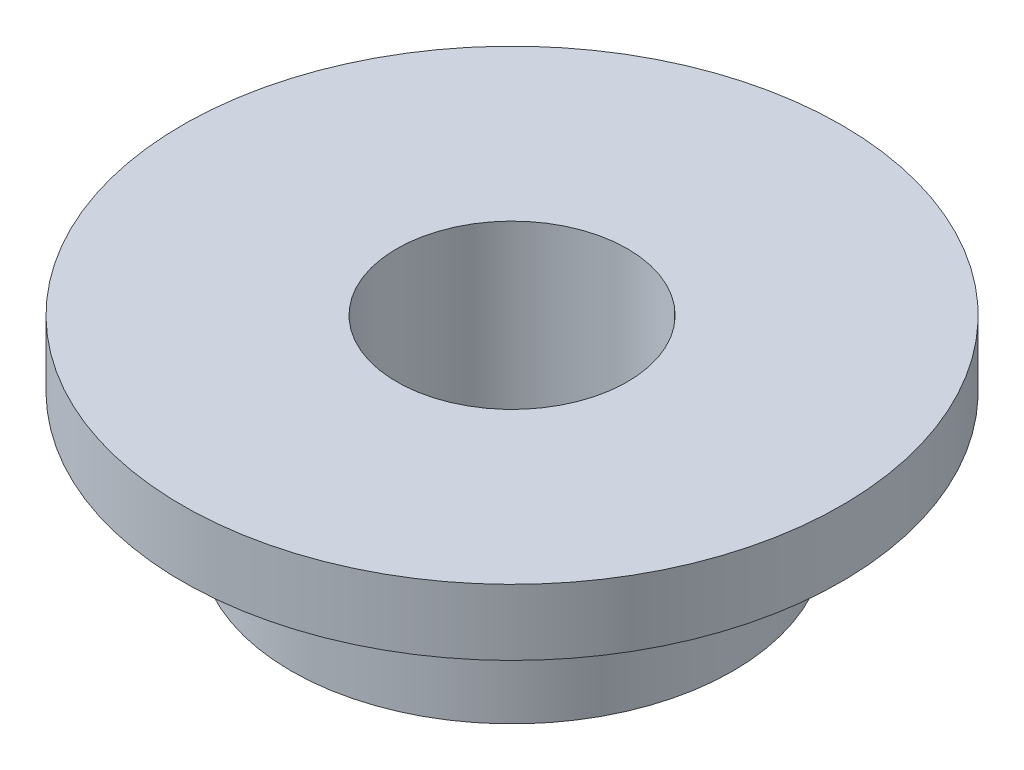
from build123d import *


with BuildPart() as part:
    # Эскиз1 → Повернуть1 (revolve)
    with BuildSketch(Plane.XY):
        Polygon((3.5, -0.353980743), (3.5, 5.646019257), (10, 5.646019257), (10, 3.646019257), (6.7, 3.646019257), (6.7, -0.353980743), align=None)
    revolve(axis=Axis((0, 0, 0), (0, 1, 0)))


solid = part.part
